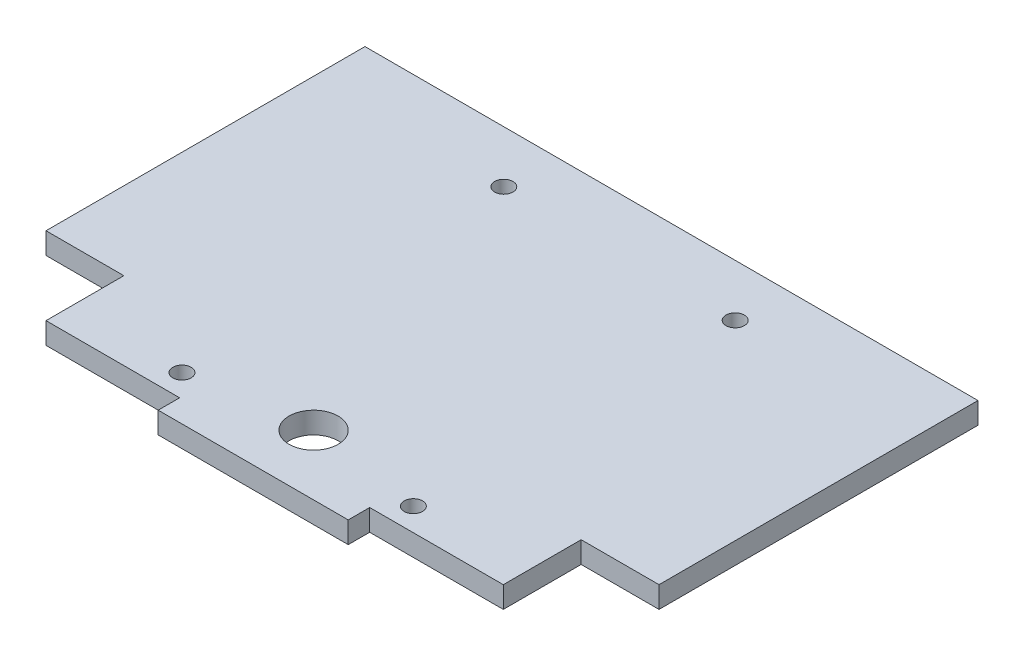
from build123d import *
from build123d.topology import SkipClean

# Parameters (mm, degrees)
BOSS_EXTRUDE1_DEPTH      = 7
F_6_0_6_DIAMETER_HOLE1_D = 6


with BuildPart() as part:
    # Sketch1 → Boss-Extrude1 (new body)
    with BuildSketch(Plane(origin=(0, 0, 0), x_dir=(1, 0, 0), z_dir=(0, 1, 0))):
        with BuildLine():
            Line((-74.6, 0), (-31, 0))
            Line((-31, 0), (-31, -7))
            Line((-31, -7), (0, -7))
            Line((0, -7), (0, 4.7))
            ThreePointArc((0, 4.7), (-8, 12.7), (0, 20.7))
            Line((0, 20.7), (0, 129.468576745))
            Line((0, 129.468576745), (-100, 129.468576745))
            Line((-100, 129.468576745), (-100, 25.4))
            Line((-100, 25.4), (-74.6, 25.4))
            Line((-74.6, 25.4), (-74.6, 0))
        make_face()
    boss_extrude1 = extrude(amount=BOSS_EXTRUDE1_DEPTH)

    # Mirror1: Boss-Extrude1 across Right Plane
    with SkipClean():  # the faces are left unmerged after this step: merging them gives an invalid solid
        add(boss_extrude1.mirror(Plane(origin=(0, 0, 0), x_dir=(0, 0, -1), z_dir=(1, 0, 0))))

    # Ø6.0 (6) Diameter Hole1 (through all)
    with Locations(Plane(origin=(-37.75, 7, -7.5), x_dir=(0, 0, 1), z_dir=(0, 1, 0))):
        with Locations((0, 0), (0, 75.5), (-105, 75.5), (-105, 0)):
            Hole(F_6_0_6_DIAMETER_HOLE1_D / 2)


solid = part.part
